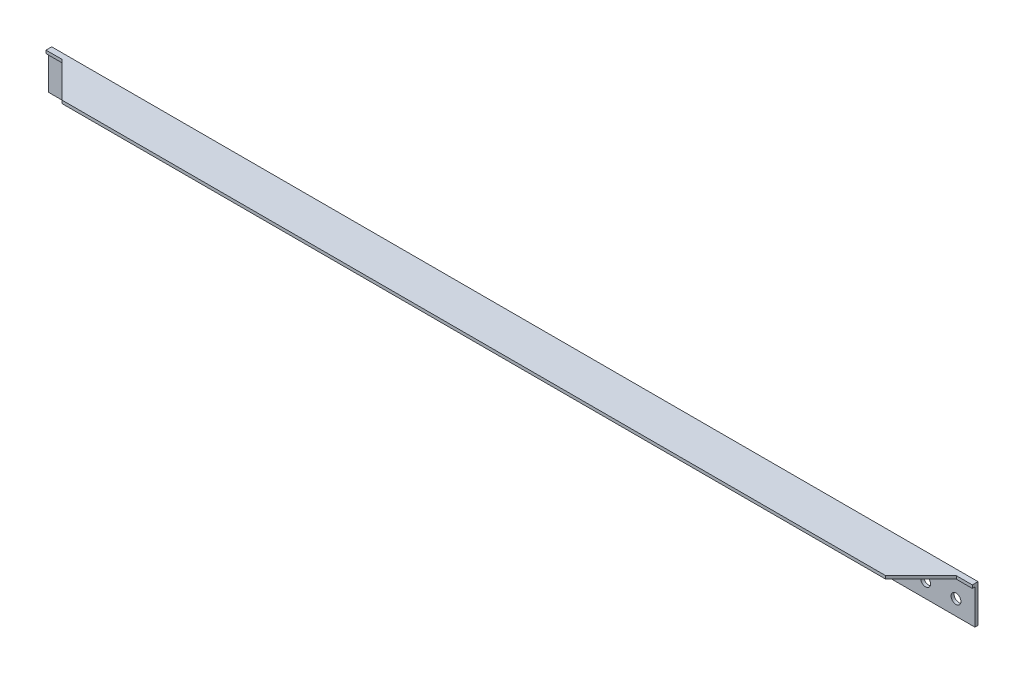
from build123d import *

# Parameters (mm, degrees)
SKETCH_1_W          = 2440
SKETCH_1_H          = 100
SKETCH_1_R          = 13
EXTRUDE_715_DEPTH   = 8
SKETCH_2_W          = 2440
SKETCH_2_H          = 8
EXTRUDE_1_DEPTH     = 100
CUT_EXTRUDE_1_DEPTH = 1229.846613699


with BuildPart() as part:
    # 草图1 → Extrude 715 (new body)
    with BuildSketch(Plane.XY):
        with Locations((0, 50)):
            Rectangle(SKETCH_1_W, SKETCH_1_H)
        with Locations((1090, 40)):
            Circle(SKETCH_1_R, mode=Mode.SUBTRACT)
        with Locations((1170, 40)):
            Circle(SKETCH_1_R, mode=Mode.SUBTRACT)
        with Locations((-1170, 40)):
            Circle(SKETCH_1_R, mode=Mode.SUBTRACT)
        with Locations((-1090, 40)):
            Circle(SKETCH_1_R, mode=Mode.SUBTRACT)
        with Locations((0, 40)):
            Circle(SKETCH_1_R, mode=Mode.SUBTRACT)
        with Locations((80, 40)):
            Circle(SKETCH_1_R, mode=Mode.SUBTRACT)
        with Locations((160, 40)):
            Circle(SKETCH_1_R, mode=Mode.SUBTRACT)
        with Locations((-160, 40)):
            Circle(SKETCH_1_R, mode=Mode.SUBTRACT)
        with Locations((-80, 40)):
            Circle(SKETCH_1_R, mode=Mode.SUBTRACT)
    extrude(amount=EXTRUDE_715_DEPTH)

    # 草图2 → 凸台-拉伸1 (add)
    with BuildSketch(Plane.XY.offset(8)):
        with Locations((0, 96)):
            Rectangle(SKETCH_2_W, SKETCH_2_H)
    extrude(amount=EXTRUDE_1_DEPTH)

    # 草图3 → 切除-拉伸1 (cut, through all)
    with BuildSketch(Plane(origin=(0, 100, 0), x_dir=(-1, 0, 0), z_dir=(0, 1, 0))):
        Polygon((-1085, 108), (-1178, 15), (-1220, 15), (-1220, 108), align=None)
        Polygon((1220, 15), (1178, 15), (1085, 108), (1220, 108), align=None)
    extrude(amount=-CUT_EXTRUDE_1_DEPTH, mode=Mode.SUBTRACT)


solid = part.part
